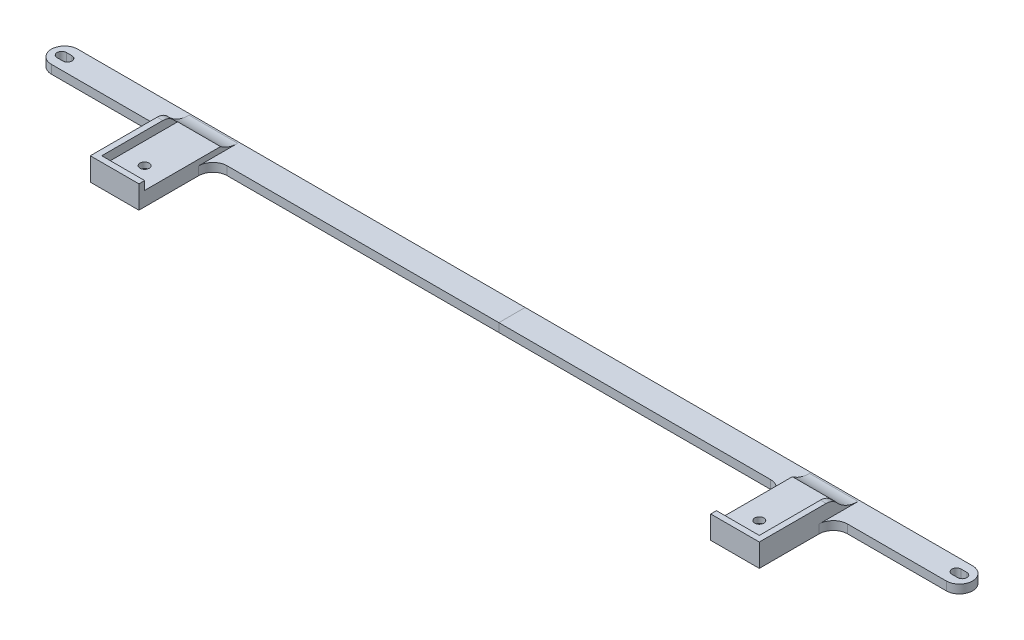
from build123d import *

# Parameters (mm, degrees)
EXTRUDE_1_DEPTH     = 3
EXTRUDE_START       = -3
EXTRUDE_3_DEPTH     = 5
EXTRUDE_5_DEPTH     = 3
CUT_EXTRUDE_1_DEPTH = 3
SKETCH_7_R          = 1.6
CUT_EXTRUDE_2_DEPTH = 2
FILLET_START        = -117
FILLET_1_DEPTH      = 17
FILLET_START_2      = 100
FILLET_1_2_DEPTH    = 17
FILLET_1_3_DEPTH    = 2
FILLET_START_3      = 115
FILLET_1_4_DEPTH    = 2
FILLET_2_R          = 5
FILLET_3_R          = 5


with BuildPart() as part:
    # Эскиз1 → Бобышка-Вытянуть1 (new body)
    with BuildSketch(Plane(origin=(0, 0, 0), x_dir=(1, 0, 0), z_dir=(0, 1, 0))):
        with BuildLine():
            Line((-156.5, 4.6), (156.5, 4.6))
            ThreePointArc((156.5, 4.6), (161.1, 0), (156.5, -4.6))
            Line((156.5, -4.6), (-156.5, -4.6))
            ThreePointArc((-156.5, -4.6), (-161.1, 0), (-156.5, 4.6))
        make_face()
        with BuildLine():
            Line((-155.5, -1.6), (-157.5, -1.6))
            ThreePointArc((-157.5, -1.6), (-159.1, 0), (-157.5, 1.6))
            Line((-157.5, 1.6), (-155.5, 1.6))
            ThreePointArc((-155.5, 1.6), (-153.9, 0), (-155.5, -1.6))
        make_face(mode=Mode.SUBTRACT)
        with BuildLine():
            Line((155.5, -1.6), (157.5, -1.6))
            ThreePointArc((157.5, -1.6), (159.1, 0), (157.5, 1.6))
            Line((157.5, 1.6), (155.5, 1.6))
            ThreePointArc((155.5, 1.6), (153.9, 0), (155.5, -1.6))
        make_face(mode=Mode.SUBTRACT)
    extrude(amount=EXTRUDE_1_DEPTH)

    # Эскиз3 → Бобышка-Вытянуть3 (add)
    with BuildSketch(Plane(origin=(0, 3, 0), x_dir=(1, 0, 0), z_dir=(0, 1, 0)).offset(EXTRUDE_START)):
        Polygon((-117, -13.5), (-117, -30.5), (-100, -30.5), (-100, -4.6), (-117, -4.6), align=None)
        Polygon((117, -4.6), (100, -4.6), (100, -30.5), (117, -30.5), (117, -13.5), align=None)
    extrude(amount=EXTRUDE_3_DEPTH)

    # Эскиз5 → Бобышка-Вытянуть5 (add)
    with BuildSketch(Plane(origin=(0, 5, 0), x_dir=(1, 0, 0), z_dir=(0, 1, 0))):
        Polygon((-117, -4.6), (-117, -30.5), (-100, -30.5), (-100, -28.5), (-115, -28.5), (-115, -4.6), align=None)
        Polygon((117, -4.6), (115, -4.6), (115, -28.5), (100, -28.5), (100, -30.5), (117, -30.5), align=None)
    extrude(amount=EXTRUDE_5_DEPTH)

    # Эскиз6 → Вырез-Вытянуть1 (cut)
    with BuildSketch(Plane.XZ):
        Polygon((107.5, 17.766838493), (104.7, 19.383419246), (104.7, 22.616580754), (107.5, 24.233161507), (110.3, 22.616580754), (110.3, 19.383419246), align=None)
        Polygon((-107.5, 24.233161507), (-110.3, 22.616580754), (-110.3, 19.383419246), (-107.5, 17.766838493), (-104.7, 19.383419246), (-104.7, 22.616580754), align=None)
    extrude(amount=-CUT_EXTRUDE_1_DEPTH, mode=Mode.SUBTRACT)

    # Эскиз7 → Вырез-Вытянуть2 (cut)
    with BuildSketch(Plane.XZ.offset(-3)):
        with Locations(Location((-107.5, 21, 0), (0, 0, 270))):
            Circle(SKETCH_7_R)
        with Locations(Location((107.5, 21, 0), (0, 0, 270))):
            Circle(SKETCH_7_R)
    extrude(amount=-CUT_EXTRUDE_2_DEPTH, mode=Mode.SUBTRACT)

    # Скругление1: read off the stored shape, not the designer's step
    # Скругление1 outline → Скругление1 (add)
    with BuildSketch(Plane.YZ.offset(FILLET_START)):
        with BuildLine():
            Line((5, 1.939745962), (5, 4.6))
            Line((5, 4.6), (3, 4.6))
            Line((3, 4.6), (3, -4.060254038))
            ThreePointArc((3, -4.060254038), (3.513167019, -0.897976378), (5, 1.939745962))
        make_face()
    extrude(amount=FILLET_1_DEPTH)

    # Fillet 1 2 outline → Fillet 1 2 (add)
    with BuildSketch(Plane.YZ.offset(FILLET_START_2)):
        with BuildLine():
            Line((5, 1.939745962), (5, 4.6))
            Line((5, 4.6), (3, 4.6))
            Line((3, 4.6), (3, -4.060254038))
            ThreePointArc((3, -4.060254038), (3.513167019, -0.897976378), (5, 1.939745962))
        make_face()
    extrude(amount=FILLET_1_2_DEPTH)

    # Fillet 1 3 outline → Fillet 1 3 (add)
    with BuildSketch(Plane.YZ.offset(FILLET_START)):
        with BuildLine():
            Line((8, 4.6), (5, 4.6))
            Line((5, 4.6), (5, 1.939745962))
            ThreePointArc((5, 1.939745962), (6.365300467, 3.42177524), (8, 4.6))
        make_face()
    extrude(amount=FILLET_1_3_DEPTH)

    # Fillet 1 4 outline → Fillet 1 4 (add)
    with BuildSketch(Plane.YZ.offset(FILLET_START_3)):
        with BuildLine():
            Line((8, 4.6), (5, 4.6))
            Line((5, 4.6), (5, 1.939745962))
            ThreePointArc((5, 1.939745962), (6.365300467, 3.42177524), (8, 4.6))
        make_face()
    extrude(amount=FILLET_1_4_DEPTH)

    # Скругление2
    fillet_2_edges = [part.edges().sort_by_distance(p)[0] for p in [
        (117, 1.5, 4.6),
        (100, 1.5, 4.6),
        (-100, 1.5, 4.6),
        (-117, 1.5, 4.6),
    ]]
    fillet(fillet_2_edges, radius=FILLET_2_R)

    # Скругление3
    fillet_3_edges = [part.edges().sort_by_distance(p)[0] for p in [
        (-116, 8, 4.6),
        (116, 8, 4.6),
    ]]
    fillet(fillet_3_edges, radius=FILLET_3_R)


with BuildPart() as body_2:
    # Split Bodies 1: the piece on the far side of the plane
    add(part.part)
    split(bisect_by=Plane(origin=(0, 0, 0), x_dir=(0, 0, 1), z_dir=(1, 0, 0)), keep=Keep.BOTTOM)


with BuildPart() as part_1:
    add(part.part)

    # Split Bodies 1
    split(bisect_by=Plane(origin=(0, 0, 0), x_dir=(0, 0, 1), z_dir=(1, 0, 0)), keep=Keep.TOP)


solid = Compound([body_2.part, part_1.part])
